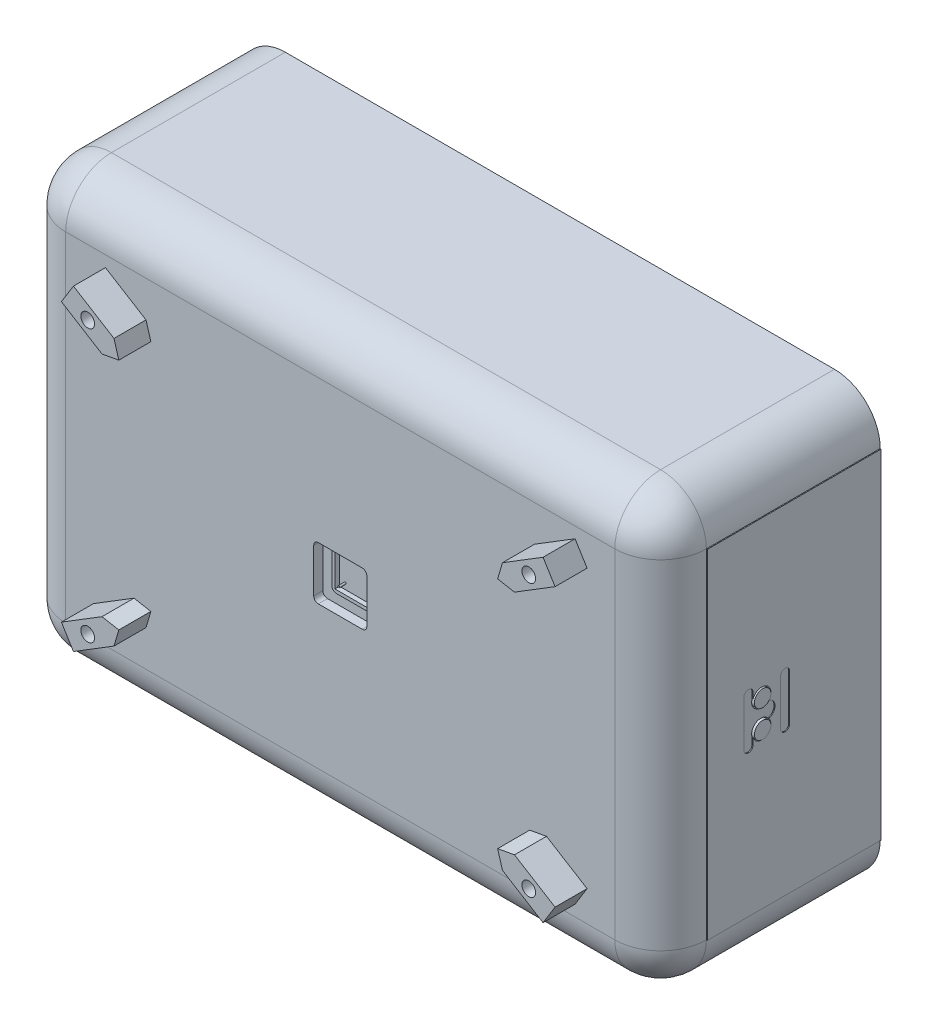
from build123d import *

# Parameters (mm, degrees)
SKETCH1_W             = 700
SKETCH1_H             = 470
SKETCH1_W_2           = 650
SKETCH1_H_2           = 436.428571428
BOSS_EXTRUDE1_DEPTH   = 240
FILLET12_R            = 25
FILLET13_R            = 50
BOSS_EXTRUDE51_DEPTH  = 15
FILLET15_R            = 25
BOSS_EXTRUDE52_START  = -30
BOSS_EXTRUDE52_DEPTH  = 10
CUT_EXTRUDE14_DEPTH   = 12
SKETCH32_R            = 10
CUT_EXTRUDE12_DEPTH   = 10
FILLET14_R            = 50
SKETCH33_R            = 9
BOSS_EXTRUDE26_DEPTH  = 12
BODY_MOVE_COPY3_ANGLE = 90
BOSS_EXTRUDE50_START  = 1
BOSS_EXTRUDE50_DEPTH  = 1
SKETCH110_W           = 600
SKETCH110_H           = 370
CUT_EXTRUDE15_DEPTH   = 20
BOSS_EXTRUDE54_DEPTH  = 26.5
SKETCH116_R           = 3.5
CUT_EXTRUDE19_DEPTH   = 30
BOSS_EXTRUDE55_DEPTH  = 5
SKETCH118_R           = 7.5
BOSS_EXTRUDE56_DEPTH  = 165
BOSS_EXTRUDE60_START  = -8
BOSS_EXTRUDE60_DEPTH  = 8
SKETCH120_W           = 55.5
SKETCH120_H           = 55.56
SKETCH120_R           = 1.0065
BOSS_EXTRUDE61_DEPTH  = 18
SKETCH121_W           = 55.5
SKETCH121_H           = 55.56
BOSS_EXTRUDE62_DEPTH  = 23
SKETCH122_R           = 1.0065
BOSS_EXTRUDE63_DEPTH  = 25
SKETCH123_W           = 10
SKETCH123_H           = 370
BOSS_EXTRUDE64_DEPTH  = 600
CUT_EXTRUDE20_DEPTH   = 10
BOSS_EXTRUDE65_DEPTH  = 35
BODY_MOVE_COPY5_ANGLE = 180
BOSS_EXTRUDE66_DEPTH  = 30
CUT_EXTRUDE22_REACH   = 527.338
SKETCH130_R           = 5
FILLET16_R            = 10
CUT_EXTRUDE23_START   = 35
SKETCH131_R           = 7.5
CUT_EXTRUDE23_DEPTH   = 15
SKETCH136_R           = 2
SKETCH136_R_2         = 5
CUT_EXTRUDE24_DEPTH   = 10


# Read off the part's stored shape, not the designer's step: Boss-Extrude66
with BuildPart() as part:
    # Sketch1 → Boss-Extrude1 (new body)
    with BuildSketch(Plane(origin=(0, 0, 0), x_dir=(1, 0, 0), z_dir=(0, 1, 0))):
        Rectangle(SKETCH1_W, SKETCH1_H)
        Rectangle(SKETCH1_W_2, SKETCH1_H_2, mode=Mode.SUBTRACT)
    extrude(amount=BOSS_EXTRUDE1_DEPTH)

    # Fillet12
    fillet12_edges = [part.edges().sort_by_distance(p)[0] for p in [
        (325, 120, 218.214285714),
        (325, 120, -218.214285714),
        (-325, 120, -218.214285714),
        (-325, 120, 218.214285714),
    ]]
    fillet(fillet12_edges, radius=FILLET12_R)

    # Fillet13
    fillet13_edges = [part.edges().sort_by_distance(p)[0] for p in [
        (-350, 120, -235),
        (350, 120, -235),
        (350, 120, 235),
        (-350, 120, 235),
    ]]
    fillet(fillet13_edges, radius=FILLET13_R)

    # Sketch106 → Boss-Extrude51 (add)
    with BuildSketch(Plane(origin=(0, 240, 0), x_dir=(1, 0, 0), z_dir=(0, 1, 0))):
        with BuildLine():
            Line((-325, 193.214285714), (-325, -193.214285714))
            ThreePointArc((-325, -193.214285714), (-317.67766953, -210.891955244), (-300, -218.214285714))
            Line((-300, -218.214285714), (300, -218.214285714))
            ThreePointArc((300, -218.214285714), (317.67766953, -210.891955244), (325, -193.214285714))
            Line((325, -193.214285714), (325, 193.214285714))
            ThreePointArc((325, 193.214285714), (317.67766953, 210.891955244), (300, 218.214285714))
            Line((300, 218.214285714), (-300, 218.214285714))
            ThreePointArc((-300, 218.214285714), (-317.67766953, 210.891955244), (-325, 193.214285714))
        make_face()
    extrude(amount=-BOSS_EXTRUDE51_DEPTH)

    # Fillet15
    fillet15_edges = [part.edges().sort_by_distance(p)[0] for p in [
        (-317.67766953, 225, -210.891955244),
        (0, 225, -218.214285714),
        (317.67766953, 225, -210.891955244),
        (325, 225, 0),
        (317.67766953, 225, 210.891955244),
        (0, 225, 218.214285714),
        (-317.67766953, 225, 210.891955244),
        (-325, 225, 0),
    ]]
    fillet(fillet15_edges, radius=FILLET15_R)

    # Sketch107 → Boss-Extrude52 (add)
    with BuildSketch(Plane(origin=(0, 0, 0), x_dir=(-1, 0, 0), z_dir=(0, -1, 0)).offset(BOSS_EXTRUDE52_START)):
        with BuildLine():
            Line((-300, 218.214285714), (300, 218.214285714))
            ThreePointArc((300, 218.214285714), (317.67766953, 210.891955244), (325, 193.214285714))
            Line((325, 193.214285714), (325, -193.214285714))
            ThreePointArc((325, -193.214285714), (317.67766953, -210.891955244), (300, -218.214285714))
            Line((300, -218.214285714), (-300, -218.214285714))
            ThreePointArc((-300, -218.214285714), (-317.67766953, -210.891955244), (-325, -193.214285714))
            Line((-325, -193.214285714), (-325, 193.214285714))
            ThreePointArc((-325, 193.214285714), (-317.67766953, 210.891955244), (-300, 218.214285714))
        make_face()
    extrude(amount=BOSS_EXTRUDE52_DEPTH)

    # Sketch109 → Cut-Extrude14 (cut)
    with BuildSketch(Plane(origin=(0, 20, 0), x_dir=(-1, 0, 0), z_dir=(0, -1, 0))):
        with BuildLine():
            Line((-64.989327676, 204.946778612), (65.000968302, 204.946778612))
            ThreePointArc((65.000968302, 204.946778612), (82.682067723, 197.621017584), (90.000966419, 179.937076473))
            Line((90.000966419, 179.937076473), (89.989327624, 149.946795781))
            ThreePointArc((89.989327624, 149.946795781), (82.659885762, 132.26201772), (64.969217617, 124.94680387))
            Line((64.969217617, 124.94680387), (-67.293574028, 125.05319613))
            ThreePointArc((-67.293574028, 125.05319613), (-83.463717501, 133.103473692), (-89.989327676, 149.946778612))
            Line((-89.989327676, 149.946778612), (-89.989327676, 179.946778612))
            ThreePointArc((-89.989327676, 179.946778612), (-82.666997206, 197.624448141), (-64.989327676, 204.946778612))
        make_face()
        with BuildLine():
            Line((-64.989327676, -204.946778612), (65.000968302, -204.946778612))
            ThreePointArc((65.000968302, -204.946778612), (82.682067723, -197.621017584), (90.000966419, -179.937076473))
            Line((90.000966419, -179.937076473), (89.989327624, -149.946795781))
            ThreePointArc((89.989327624, -149.946795781), (82.659885762, -132.26201772), (64.969217617, -124.94680387))
            Line((64.969217617, -124.94680387), (-67.293574028, -125.05319613))
            ThreePointArc((-67.293574028, -125.05319613), (-83.463717501, -133.103473692), (-89.989327676, -149.946778612))
            Line((-89.989327676, -149.946778612), (-89.989327676, -179.946778612))
            ThreePointArc((-89.989327676, -179.946778612), (-82.666997206, -197.624448141), (-64.989327676, -204.946778612))
        make_face()
    extrude(amount=-CUT_EXTRUDE14_DEPTH, mode=Mode.SUBTRACT)

    # Sketch32 → Cut-Extrude12 (cut)
    with BuildSketch(Plane.ZY.offset(350)):
        with Locations((-15, 130.489963136)):
            Circle(SKETCH32_R)
        with Locations((15, 130.489963136)):
            Circle(SKETCH32_R)
    extrude(amount=-CUT_EXTRUDE12_DEPTH, mode=Mode.SUBTRACT)

    # Fillet14
    fillet14_edges = [part.edges().sort_by_distance(p)[0] for p in [
        (0, 240, -235),
        (350, 240, 0),
        (-350, 240, 0),
        (0, 240, 235),
        (-335.355339059, 240, -220.355339059),
        (-335.355339059, 240, 220.355339059),
        (335.355339059, 240, 220.355339059),
        (335.355339059, 240, -220.355339059),
    ]]
    fillet(fillet14_edges, radius=FILLET14_R)

    # Sketch33 → Boss-Extrude26 (add)
    with BuildSketch(Plane.ZY.offset(340)):
        with Locations((-15, 130.489963136)):
            Circle(SKETCH33_R)
        with Locations((15, 130.489963136)):
            Circle(SKETCH33_R)
    extrude(amount=BOSS_EXTRUDE26_DEPTH)


with BuildPart() as part_1:
    # Body-Move/Copy3: moved
    add(part.part.rotate(Axis((0, 125, 0), (1, 0, 0)), BODY_MOVE_COPY3_ANGLE))

    # Sketch95 → Boss-Extrude50 (add)
    with BuildSketch(Plane.ZY.offset(350).offset(BOSS_EXTRUDE50_START)):
        Polygon((65, -60), (65, 125), (65, 310), (-125, 310), (-125, -60), align=None)
        with BuildLine():
            Line((-15, 150), (-15, 125))
            Line((-15, 125), (-15, 100))
            ThreePointArc((-15, 100), (-20, 95), (-25, 100))
            Line((-25, 100), (-25, 150))
            ThreePointArc((-25, 150), (-20, 155), (-15, 150))
        make_face(mode=Mode.SUBTRACT)
        with BuildLine():
            ThreePointArc((-2.280977587, 116.293844634), (-7.124913974, 119.501309169), (-9, 125))
            ThreePointArc((-9, 125), (-7.124913974, 130.498690831), (-2.280977587, 133.706155366))
            ThreePointArc((-2.280977587, 133.706155366), (0.717262266, 148.78756658), (15, 143.091795408))
            Line((15, 143.091795408), (15, 150))
            ThreePointArc((15, 150), (20, 155), (25, 150))
            Line((25, 150), (25, 125))
            Line((25, 125), (25, 100))
            ThreePointArc((25, 100), (20, 95), (15, 100))
            Line((15, 100), (15, 106.908204592))
            ThreePointArc((15, 106.908204592), (8.802685303, 100.564647762), (0, 101.641752291))
            ThreePointArc((0, 101.641752291), (-4.391020889, 108.46176897), (-2.280977587, 116.293844634))
        make_face(mode=Mode.SUBTRACT)
    extrude(amount=-BOSS_EXTRUDE50_DEPTH)

    # Sketch110 → Cut-Extrude15 (cut)
    with BuildSketch(Plane.XY.offset(115)):
        with Locations((0, 125)):
            Rectangle(SKETCH110_W, SKETCH110_H)
    extrude(amount=-CUT_EXTRUDE15_DEPTH, mode=Mode.SUBTRACT)

    # Sketch115 → Boss-Extrude54 (add)
    with BuildSketch(Plane.XY.offset(-95)):
        with BuildLine():
            Line((0, 140.3), (0, 145.3))
            Line((0, 145.3), (-18, 145.3))
            ThreePointArc((-18, 145.3), (-23.656854249, 142.956854249), (-26, 137.3))
            Line((-26, 137.3), (-26, 112.7))
            ThreePointArc((-26, 112.7), (-23.656854249, 107.043145751), (-18, 104.7))
            Line((-18, 104.7), (0, 104.7))
            Line((0, 104.7), (0, 109.7))
            Line((0, 109.7), (-18, 109.7))
            ThreePointArc((-18, 109.7), (-20.121320344, 110.578679656), (-21, 112.7))
            Line((-21, 112.7), (-21, 137.3))
            ThreePointArc((-21, 137.3), (-20.121320344, 139.421320344), (-18, 140.3))
            Line((-18, 140.3), (0, 140.3))
        make_face()
        with BuildLine():
            Line((18, 145.3), (0, 145.3))
            Line((0, 145.3), (0, 140.3))
            Line((0, 140.3), (18, 140.3))
            ThreePointArc((18, 140.3), (20.121320344, 139.421320344), (21, 137.3))
            Line((21, 137.3), (21, 125))
            Line((21, 125), (26, 125))
            Line((26, 125), (26, 137.3))
            ThreePointArc((26, 137.3), (23.656854249, 142.956854249), (18, 145.3))
        make_face()
        with BuildLine():
            Line((18, 109.7), (0, 109.7))
            Line((0, 109.7), (0, 104.7))
            Line((0, 104.7), (18, 104.7))
            ThreePointArc((18, 104.7), (23.656854249, 107.043145751), (26, 112.7))
            Line((26, 112.7), (26, 125))
            Line((26, 125), (21, 125))
            Line((21, 125), (21, 112.7))
            ThreePointArc((21, 112.7), (20.121320344, 110.578679656), (18, 109.7))
        make_face()
    extrude(amount=BOSS_EXTRUDE54_DEPTH)

    # Sketch116 → Cut-Extrude19 (cut)
    with BuildSketch(Plane(origin=(26, 0, 0), x_dir=(0, 0, -1), z_dir=(1, 0, 0))):
        with Locations(Location((87.004972366, 125, 0), (0, 0, 90))):
            Circle(SKETCH116_R)
    extrude(amount=-CUT_EXTRUDE19_DEPTH, mode=Mode.SUBTRACT)

    # Sketch117 → Boss-Extrude55 (add)
    with BuildSketch(Plane.XY.offset(-68.5)):
        with BuildLine():
            Line((-26, 137.3), (-26, 112.7))
            ThreePointArc((-26, 112.7), (-23.656854249, 107.043145751), (-18, 104.7))
            Line((-18, 104.7), (18, 104.7))
            ThreePointArc((18, 104.7), (23.656854249, 107.043145751), (26, 112.7))
            Line((26, 112.7), (26, 137.3))
            ThreePointArc((26, 137.3), (23.656854249, 142.956854249), (18, 145.3))
            Line((18, 145.3), (-18, 145.3))
            ThreePointArc((-18, 145.3), (-23.656854249, 142.956854249), (-26, 137.3))
        make_face()
    extrude(amount=BOSS_EXTRUDE55_DEPTH)

    # Sketch118 → Boss-Extrude56 (add)
    with BuildSketch(Plane.XY.offset(-95)):
        with Locations((-100, 212.828571429)):
            Circle(SKETCH118_R)
        with Locations((-100, 37.171428571)):
            Circle(SKETCH118_R)
        with Locations((100, 37.171428571)):
            Circle(SKETCH118_R)
        with Locations((100, 212.828571429)):
            Circle(SKETCH118_R)
    extrude(amount=BOSS_EXTRUDE56_DEPTH)

    # Sketch119 → Boss-Extrude60 (add)
    with BuildSketch(Plane.XY.offset(70).offset(BOSS_EXTRUDE60_START)):
        with BuildLine():
            ThreePointArc((-107.5, 37.171428571), (-94.696699141, 42.47472943), (-100, 29.671428571))
            Line((-100, 29.671428571), (100, 29.671428571))
            ThreePointArc((100, 29.671428571), (94.696699141, 42.47472943), (107.5, 37.171428571))
            Line((107.5, 37.171428571), (107.5, 212.828571429))
            ThreePointArc((107.5, 212.828571429), (94.696699141, 207.52527057), (100, 220.328571429))
            Line((100, 220.328571429), (-100, 220.328571429))
            ThreePointArc((-100, 220.328571429), (-94.696699141, 207.52527057), (-107.5, 212.828571429))
            Line((-107.5, 212.828571429), (-107.5, 37.171428571))
        make_face()
    extrude(amount=BOSS_EXTRUDE60_DEPTH)

    # Sketch120 → Boss-Extrude61 (add)
    with BuildSketch(Plane.XY.offset(70)):
        with Locations((0, 125)):
            Rectangle(SKETCH120_W, SKETCH120_H)
        with Locations((-21.5, 146.5)):
            Circle(SKETCH120_R, mode=Mode.SUBTRACT)
        with Locations((21.5, 146.5)):
            Circle(SKETCH120_R, mode=Mode.SUBTRACT)
        with Locations((21.5, 103.499972253)):
            Circle(SKETCH120_R, mode=Mode.SUBTRACT)
        with Locations((-21.5, 103.499972253)):
            Circle(SKETCH120_R, mode=Mode.SUBTRACT)
    extrude(amount=BOSS_EXTRUDE61_DEPTH)

    # Sketch121 → Boss-Extrude62 (add)
    with BuildSketch(Plane.XY.offset(70)):
        with BuildLine():
            Line((-31.25, 151.28), (-31.25, 98.72))
            ThreePointArc((-31.25, 98.72), (-29.785533906, 95.184466094), (-26.25, 93.72))
            Line((-26.25, 93.72), (26.25, 93.72))
            ThreePointArc((26.25, 93.72), (29.785533906, 95.184466094), (31.25, 98.72))
            Line((31.25, 98.72), (31.25, 151.28))
            ThreePointArc((31.25, 151.28), (29.785533906, 154.815533906), (26.25, 156.28))
            Line((26.25, 156.28), (-26.25, 156.28))
            ThreePointArc((-26.25, 156.28), (-29.785533906, 154.815533906), (-31.25, 151.28))
        make_face()
        with Locations((0, 125)):
            Rectangle(SKETCH121_W, SKETCH121_H, mode=Mode.SUBTRACT)
    extrude(amount=BOSS_EXTRUDE62_DEPTH)

    # Sketch122 → Boss-Extrude63 (add)
    with BuildSketch(Plane.XY.offset(70)):
        with Locations((-21.5, 146.5)):
            Circle(SKETCH122_R)
        with Locations((21.5, 146.5)):
            Circle(SKETCH122_R)
        with Locations((21.5, 103.499972253)):
            Circle(SKETCH122_R)
        with Locations((-21.5, 103.499972253)):
            Circle(SKETCH122_R)
    extrude(amount=BOSS_EXTRUDE63_DEPTH)

    # Sketch123 → Boss-Extrude64 (add)
    with BuildSketch(Plane(origin=(-300, 0, 0), x_dir=(0, 0, -1), z_dir=(1, 0, 0))):
        with Locations((-110, 125)):
            Rectangle(SKETCH123_W, SKETCH123_H)
    extrude(amount=BOSS_EXTRUDE64_DEPTH)

    # Sketch124 → Cut-Extrude20 (cut)
    with BuildSketch(Plane.XY.offset(115)):
        with BuildLine():
            Line((-29, 149), (-29, 142.883333333))
            Line((-29, 142.883333333), (29, 107.116666667))
            Line((29, 107.116666667), (29, 149))
            ThreePointArc((29, 149), (27.535533906, 152.535533906), (24, 154))
            Line((24, 154), (-24, 154))
            ThreePointArc((-24, 154), (-27.535533906, 152.535533906), (-29, 149))
        make_face()
        with BuildLine():
            Line((29, 107.116666667), (-29, 142.883333333))
            Line((-29, 142.883333333), (-29, 101))
            ThreePointArc((-29, 101), (-27.535533906, 97.464466094), (-24, 96))
            Line((-24, 96), (24, 96))
            ThreePointArc((24, 96), (27.535533906, 97.464466094), (29, 101))
            Line((29, 101), (29, 107.116666667))
        make_face()
    extrude(amount=-CUT_EXTRUDE20_DEPTH, mode=Mode.SUBTRACT)

    # Sketch126 → Boss-Extrude65 (add)
    with BuildSketch(Plane.XY.offset(115)):
        Polygon((-263.127284558, -37.261825478), (-256.566175771, -47.901461349), (-212.248364456, -20.572144372), (-206.960643995, -2.625730463), (-225.361200412, 0.712912703), (-269.688393346, -26.622189606), align=None)
        Polygon((225.361200412, 0.712912703), (206.960643995, -2.625730463), (263.127284558, -37.261825478), (269.688393346, -26.622189606), align=None)
        Polygon((263.127284558, -37.261825478), (206.960643995, -2.625730463), (212.248364456, -20.572144372), (256.566175771, -47.901461349), align=None)
        Polygon((263.127284558, 287.261825478), (256.566175771, 297.901461349), (212.248364456, 270.572144372), (206.960643995, 252.625730463), (225.361200412, 249.287087297), (269.688393346, 276.622189606), align=None)
        Polygon((-256.566175771, 297.901461349), (-263.127284558, 287.261825478), (-218.809473243, 259.9325085), (-212.248364456, 270.572144372), align=None)
        Polygon((-263.127284558, 287.261825478), (-269.688393346, 276.622189606), (-225.361200412, 249.287087297), (-218.800091625, 259.926723169), (-218.809473243, 259.9325085), align=None)
        Polygon((-218.800091625, 259.926723169), (-225.361200412, 249.287087297), (-206.960643995, 252.625730463), align=None)
        Polygon((-212.248364456, 270.572144372), (-218.809473243, 259.9325085), (-218.800091625, 259.926723169), (-206.960643995, 252.625730463), align=None)
    extrude(amount=BOSS_EXTRUDE65_DEPTH)


with BuildPart() as part_2:
    # Body-Move/Copy5: moved
    add(part_1.part.rotate(Axis((0, 0, 0), (0, 0, 1)), BODY_MOVE_COPY5_ANGLE))

    # Boss-Extrude66 outline → Boss-Extrude66 (add)
    with BuildSketch(Plane(origin=(0, 0, -105), x_dir=(-1, 0, 0), z_dir=(0, 0, -1))):
        Polygon((-48.837821794, -25.033237031), (51.162178206, -25.033237031), (51.162178206, -0.033237031), (-40.156827801, -0.033237031), (-48.837821794, -0.040220027), align=None)
        Polygon((51.162178206, -249.966762969), (51.162178206, -224.966762969), (-48.837821794, -224.966762969), (-48.837821794, -249.959779973), (-40.156827806, -249.96676297), align=None)
    extrude(amount=BOSS_EXTRUDE66_DEPTH)

    # Cut-Extrude22: up to this face of the body (flat: up to its plane)
    cut_extrude22_end = Plane(part_2.part.faces().sort_by_distance((-5.502675202, -0.033237031, -120))[0])
    # Sketch130 → Cut-Extrude22 (cut, up to the picked face)
    with BuildSketch(Plane.XZ.offset(249.966762969), mode=Mode.PRIVATE) as cut_extrude22_sk1:
        with Locations(Location((-0.002178206, -125, 0), (0, 0, 270))):
            Circle(SKETCH130_R)
    cut_extrude22_tool1 = split(extrude(cut_extrude22_sk1.sketch, amount=-CUT_EXTRUDE22_REACH, mode=Mode.PRIVATE), bisect_by=cut_extrude22_end, keep=Keep.BOTH, mode=Mode.PRIVATE)
    add(cut_extrude22_tool1.solids().sort_by(Axis((-0.002178, -249.966763, -125), (0, 1, 0)))[0], mode=Mode.SUBTRACT)

    # Fillet16
    fillet16_edges = [part_2.edges().sort_by_distance(p)[0] for p in [
        (-51.162178206, -237.466762969, -135),
        (48.837821794, -237.463271471, -135),
        (-51.162178206, -12.533237031, -135),
        (48.837821794, -12.536728529, -135),
        (-1.162178206, -25.033237031, -105),
        (-1.162178206, -224.966762969, -105),
    ]]
    fillet(fillet16_edges, radius=FILLET16_R)

    # Sketch131 → Cut-Extrude23 (cut)
    with BuildSketch(Plane.XY.offset(115).offset(CUT_EXTRUDE23_START)):
        with BuildLine():
            ThreePointArc((-233.466033497, 23.595720656), (-238.920106008, 30.811271966), (-247.349815019, 27.532385929))
            Line((-247.349815019, 27.532385929), (-234.582251974, 19.659055384))
            ThreePointArc((-234.582251974, 19.659055384), (-233.750482186, 21.549793168), (-233.466033497, 23.595720656))
        make_face()
        with BuildLine():
            Line((-234.582251974, 19.659055384), (-247.349815019, 27.532385929))
            ThreePointArc((-247.349815019, 27.532385929), (-244.902698769, 17.211939133), (-234.582251974, 19.659055384))
        make_face()
        with Locations((-240.966033497, -273.595720656)):
            Circle(SKETCH131_R)
        with BuildLine():
            ThreePointArc((248.466033497, -273.595720656), (243.011960985, -266.380169346), (234.582251974, -269.659055384))
            Line((234.582251974, -269.659055384), (247.349815019, -277.532385929))
            ThreePointArc((247.349815019, -277.532385929), (248.181584807, -275.641648145), (248.466033497, -273.595720656))
        make_face()
        with BuildLine():
            Line((247.349815019, -277.532385929), (234.582251974, -269.659055384))
            ThreePointArc((234.582251974, -269.659055384), (237.029368224, -279.979502179), (247.349815019, -277.532385929))
        make_face()
        with Locations((240.966033497, 23.595720656)):
            Circle(SKETCH131_R)
    extrude(amount=-CUT_EXTRUDE23_DEPTH, mode=Mode.SUBTRACT)

    # Sketch136 → Cut-Extrude24 (cut)
    with BuildSketch(Plane(origin=(0, 0, -105), x_dir=(-1, 0, 0), z_dir=(0, 0, -1))):
        with Locations(Location((-266.92047039, 50.237803722, 0), (0, 0, 90))):
            Circle(SKETCH136_R)
        with Locations(Location((-234.92047039, 50.237803722, 0), (0, 0, 90))):
            Circle(SKETCH136_R)
        with Locations(Location((-266.92047039, 18.237803722, 0), (0, 0, 90))):
            Circle(SKETCH136_R)
        with Locations(Location((-234.92047039, 18.237803722, 0), (0, 0, 90))):
            Circle(SKETCH136_R)
        with Locations(Location((-250.92047039, 33.329939993, 0), (0, 0, 90))):
            Circle(SKETCH136_R_2)
        with Locations(Location((-267.092963029, -268.010961903, 0), (0, 0, 90))):
            Circle(SKETCH136_R)
        with Locations(Location((-235.092963029, -268.010961903, 0), (0, 0, 90))):
            Circle(SKETCH136_R)
        with Locations(Location((-267.092963029, -300.010961903, 0), (0, 0, 90))):
            Circle(SKETCH136_R)
        with Locations(Location((-235.092963029, -300.010961903, 0), (0, 0, 90))):
            Circle(SKETCH136_R)
        with Locations(Location((-251.092963029, -284.918825632, 0), (0, 0, 90))):
            Circle(SKETCH136_R_2)
        with Locations(Location((235.151470195, -268.30616, 0), (0, 0, 90))):
            Circle(SKETCH136_R)
        with Locations(Location((267.151470195, -268.30616, 0), (0, 0, 90))):
            Circle(SKETCH136_R)
        with Locations(Location((235.151470195, -300.30616, 0), (0, 0, 90))):
            Circle(SKETCH136_R)
        with Locations(Location((267.151470195, -300.30616, 0), (0, 0, 90))):
            Circle(SKETCH136_R)
        with Locations(Location((251.151470195, -285.214023729, 0), (0, 0, 90))):
            Circle(SKETCH136_R_2)
        with Locations(Location((234.977195397, 50.044625457, 0), (0, 0, 90))):
            Circle(SKETCH136_R)
        with Locations(Location((266.977195397, 50.044625457, 0), (0, 0, 90))):
            Circle(SKETCH136_R)
        with Locations(Location((234.977195397, 18.044625457, 0), (0, 0, 90))):
            Circle(SKETCH136_R)
        with Locations(Location((266.977195397, 18.044625457, 0), (0, 0, 90))):
            Circle(SKETCH136_R)
        with Locations(Location((250.977195397, 33.136761728, 0), (0, 0, 90))):
            Circle(SKETCH136_R_2)
    extrude(amount=-CUT_EXTRUDE24_DEPTH, mode=Mode.SUBTRACT)


solid = part_2.part
